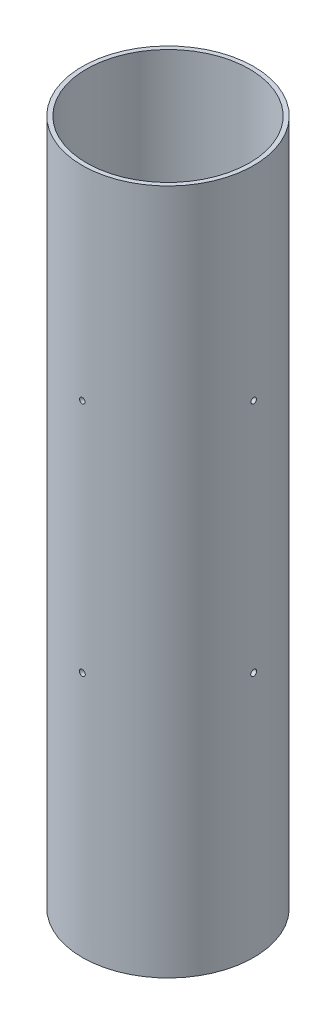
from build123d import *

# Parameters (mm, degrees)
SKETCH1_R               = 50.8
SKETCH1_R_2             = 48.26
COUPLER_EXTRUSION_DEPTH = 406.4
BULKHEAD_HOLE_REACH     = 423.976
SKETCH2_R               = 1.6383
CIRPATTERN1_COUNT       = 4
CUT_EXTRUDE1_REACH      = 423.976
SKETCH3_R               = 1.7526
CIRPATTERN2_COUNT       = 4


with BuildPart() as part:
    # Sketch1 → Coupler Extrusion (new body)
    with BuildSketch(Plane(origin=(0, 0, 0), x_dir=(1, 0, 0), z_dir=(0, 1, 0))):
        Circle(SKETCH1_R)
        Circle(SKETCH1_R_2, mode=Mode.SUBTRACT)
    extrude(amount=COUPLER_EXTRUSION_DEPTH)

    # Sketch2 → Bulkhead Hole (cut, up to next)
    with BuildSketch(Plane.XY.offset(50.8), mode=Mode.PRIVATE) as bulkhead_hole_sk1:
        with Locations((0, 285.75)):
            Circle(SKETCH2_R)
    bulkhead_hole_tool1 = extrude(bulkhead_hole_sk1.sketch, amount=-BULKHEAD_HOLE_REACH, mode=Mode.PRIVATE) & part.part
    bulkhead_hole = bulkhead_hole_tool1.solids().sort_by_distance((0, 285.75, 50.8))[0]
    add(bulkhead_hole, mode=Mode.SUBTRACT)

    # CirPattern1: Bulkhead Hole ×4 about axis
    cirpattern1_axis = Axis((0, 406.4, 0), (0, -1, 0))
    for i in range(1, CIRPATTERN1_COUNT):
        add(bulkhead_hole.rotate(cirpattern1_axis, i * 360 / CIRPATTERN1_COUNT), mode=Mode.SUBTRACT)

    # Sketch3 → Cut-Extrude1 (cut, up to next)
    with BuildSketch(Plane.XY.offset(50.8), mode=Mode.PRIVATE) as cut_extrude1_sk1:
        with Locations((0, 146.05)):
            Circle(SKETCH3_R)
    cut_extrude1_tool1 = extrude(cut_extrude1_sk1.sketch, amount=-CUT_EXTRUDE1_REACH, mode=Mode.PRIVATE) & part.part
    cut_extrude1 = cut_extrude1_tool1.solids().sort_by_distance((0, 146.05, 50.8))[0]
    add(cut_extrude1, mode=Mode.SUBTRACT)

    # CirPattern2: Cut-Extrude1 ×4 about axis
    cirpattern2_axis = Axis((0, 406.4, 0), (0, -1, 0))
    for i in range(1, CIRPATTERN2_COUNT):
        add(cut_extrude1.rotate(cirpattern2_axis, i * 360 / CIRPATTERN2_COUNT), mode=Mode.SUBTRACT)


solid = part.part
